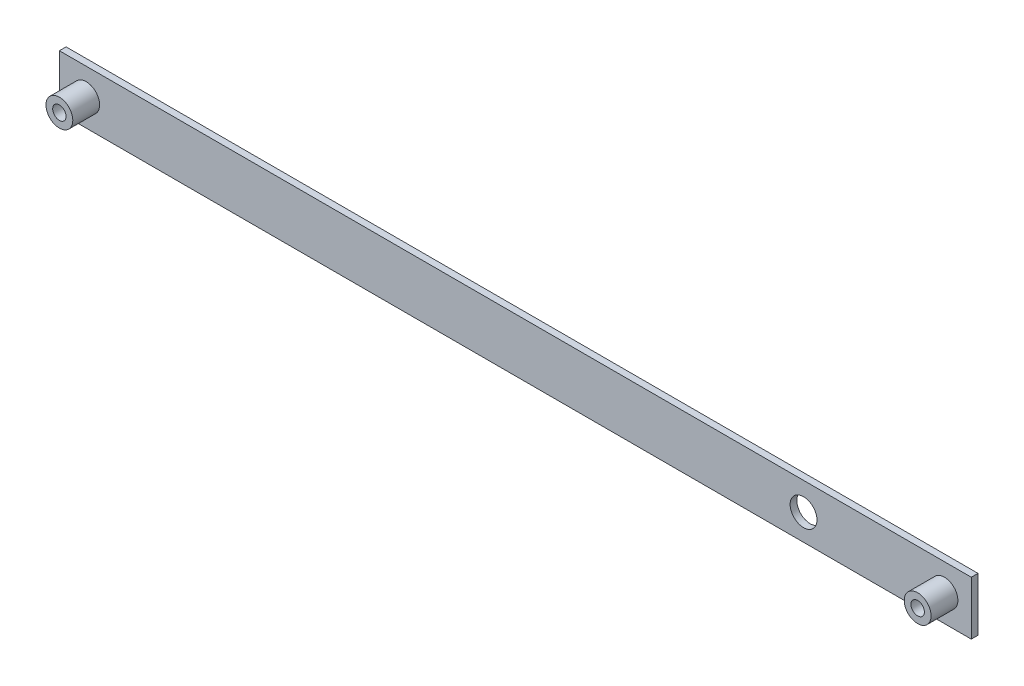
from build123d import *

# Parameters (mm, degrees)
SKETCH1_W           = 431.8
SKETCH1_H           = 25.4
SKETCH1_R           = 3.175
BOSS_EXTRUDE1_DEPTH = 3.175
SKETCH2_R           = 6.35
SKETCH2_R_2         = 3.175
BOSS_EXTRUDE2_DEPTH = 12.7
CUT_EXTRUDE1_REACH  = 421.485
SKETCH3_R           = 6.35


with BuildPart() as part:
    # Sketch1 → Boss-Extrude1 (new body)
    with BuildSketch(Plane.XY):
        with Locations((203.2, 0)):
            Rectangle(SKETCH1_W, SKETCH1_H)
        Circle(SKETCH1_R, mode=Mode.SUBTRACT)
        with Locations((406.4, 0)):
            Circle(SKETCH1_R, mode=Mode.SUBTRACT)
    extrude(amount=BOSS_EXTRUDE1_DEPTH)

    # Sketch2 → Boss-Extrude2 (add)
    # profile 1 of 2: a face of its own
    with BuildSketch(Plane.XY.offset(3.175)):
        Circle(SKETCH2_R)
        Circle(SKETCH2_R_2, mode=Mode.SUBTRACT)
    # profile 2 of 2: a face of its own
    with BuildSketch(Plane.XY.offset(3.175)):
        with Locations((406.4, 0)):
            Circle(SKETCH2_R)
        with Locations((406.4, 0)):
            Circle(SKETCH2_R_2, mode=Mode.SUBTRACT)
    extrude(amount=BOSS_EXTRUDE2_DEPTH)

    # Sketch3 → Cut-Extrude1 (cut, up to next)
    with BuildSketch(Plane.XY.offset(3.175), mode=Mode.PRIVATE) as cut_extrude1_sk1:
        with Locations((339.668299959, -0.339967612)):
            Circle(SKETCH3_R)
    cut_extrude1_tool1 = extrude(cut_extrude1_sk1.sketch, amount=-CUT_EXTRUDE1_REACH, mode=Mode.PRIVATE) & part.part
    add(cut_extrude1_tool1.solids().sort_by_distance((339.6683, -0.339968, 3.175))[0], mode=Mode.SUBTRACT)


solid = part.part
